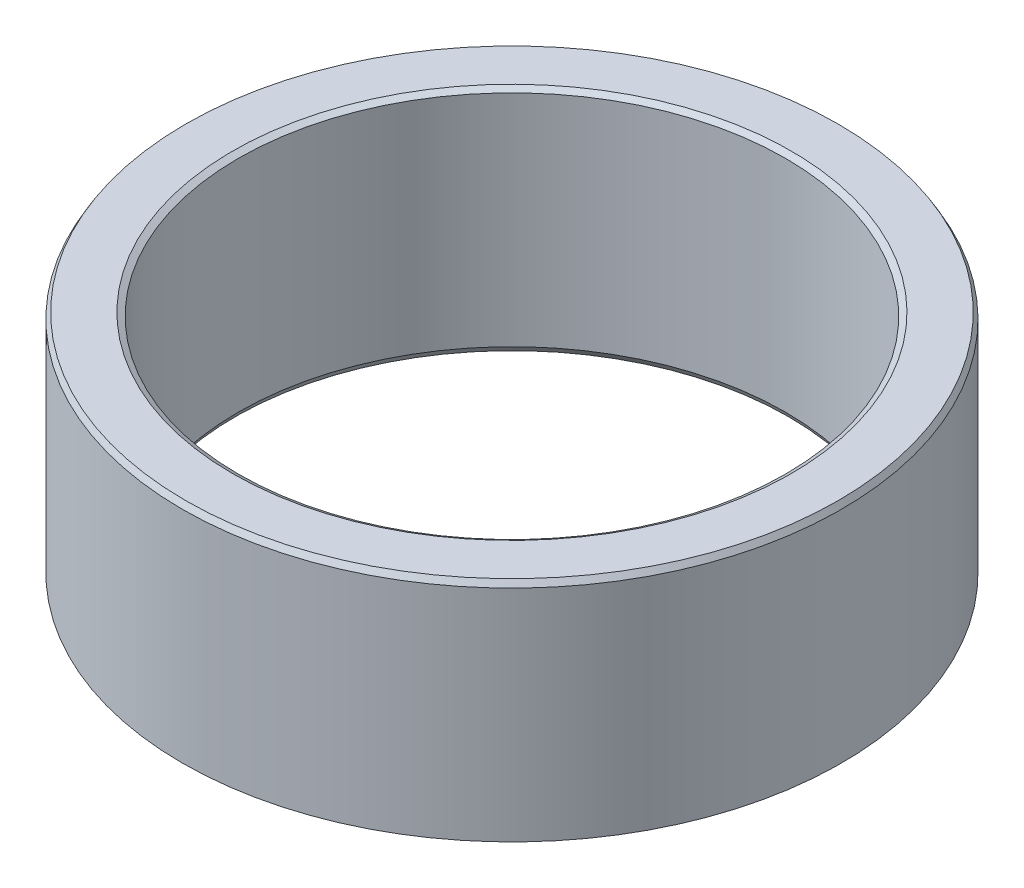
from build123d import *
from OCP.BRepFilletAPI import BRepFilletAPI_MakeChamfer

# Parameters (mm, degrees)
SKETCH1_R           = 52.5
BOSS_EXTRUDE1_DEPTH = 36.47889402
SKETCH2_R           = 43.573542565
CUT_EXTRUDE1_DEPTH  = 83.723694967
CHAMFER1_SIZE       = 0.926597238
CHAMFER1_SIZE2      = 0.534971165


with BuildPart() as part:
    # Sketch1 → Boss-Extrude1 (new body)
    with BuildSketch(Plane(origin=(0, 0, 0), x_dir=(1, 0, 0), z_dir=(0, 1, 0))):
        Circle(SKETCH1_R)
    extrude(amount=BOSS_EXTRUDE1_DEPTH)

    # Sketch2 → Cut-Extrude1 (cut, through all)
    with BuildSketch(Plane(origin=(0, 0, 0), x_dir=(1, 0, 0), z_dir=(0, 1, 0))):
        Circle(SKETCH2_R)
    extrude(amount=CUT_EXTRUDE1_DEPTH, mode=Mode.SUBTRACT)

    # Chamfer1: one chamfer whose edges measure the first distance from different faces: ONE call of the kernel's chamfer builder (chamfer() names one face for all edges)
    chamfer1_edges_1 = [part.edges().sort_by_distance(p)[0] for p in [
        (-43.573542565, 36.47889402, 0),
    ]]
    chamfer1_side_1 = [part.faces().sort_by_distance(p)[0] for p in [
        (-51.01507576, 36.47889402, 0),
    ]]
    chamfer1_edges_2 = [part.edges().sort_by_distance(p)[0] for p in [
        (-43.573542565, 0, 0),
    ]]
    chamfer1_side_2 = [part.faces().sort_by_distance(p)[0] for p in [
        (-43.573542565, 18.23944701, 0),
    ]]
    chamfer1_edges_3 = [part.edges().sort_by_distance(p)[0] for p in [
        (-52.5, 0, 0),
    ]]
    chamfer1_side_3 = [part.faces().sort_by_distance(p)[0] for p in [
        (-51.01507576, 0, 0),
    ]]
    chamfer1_edges_4 = [part.edges().sort_by_distance(p)[0] for p in [
        (-52.5, 36.47889402, 0),
    ]]
    chamfer1_side_4 = [part.faces().sort_by_distance(p)[0] for p in [
        (-52.5, 18.23944701, 0),
    ]]
    chamfer1 = BRepFilletAPI_MakeChamfer(part.part.solid().wrapped)
    for e in chamfer1_edges_1:
        chamfer1.Add(CHAMFER1_SIZE, CHAMFER1_SIZE2, e.wrapped, chamfer1_side_1[0].wrapped)  # the first distance lies on this face
    for e in chamfer1_edges_2:
        chamfer1.Add(CHAMFER1_SIZE, CHAMFER1_SIZE2, e.wrapped, chamfer1_side_2[0].wrapped)  # the first distance lies on this face
    for e in chamfer1_edges_3:
        chamfer1.Add(CHAMFER1_SIZE, CHAMFER1_SIZE2, e.wrapped, chamfer1_side_3[0].wrapped)  # the first distance lies on this face
    for e in chamfer1_edges_4:
        chamfer1.Add(CHAMFER1_SIZE, CHAMFER1_SIZE2, e.wrapped, chamfer1_side_4[0].wrapped)  # the first distance lies on this face
    add(Compound.cast(chamfer1.Shape()), mode=Mode.REPLACE)


solid = part.part
